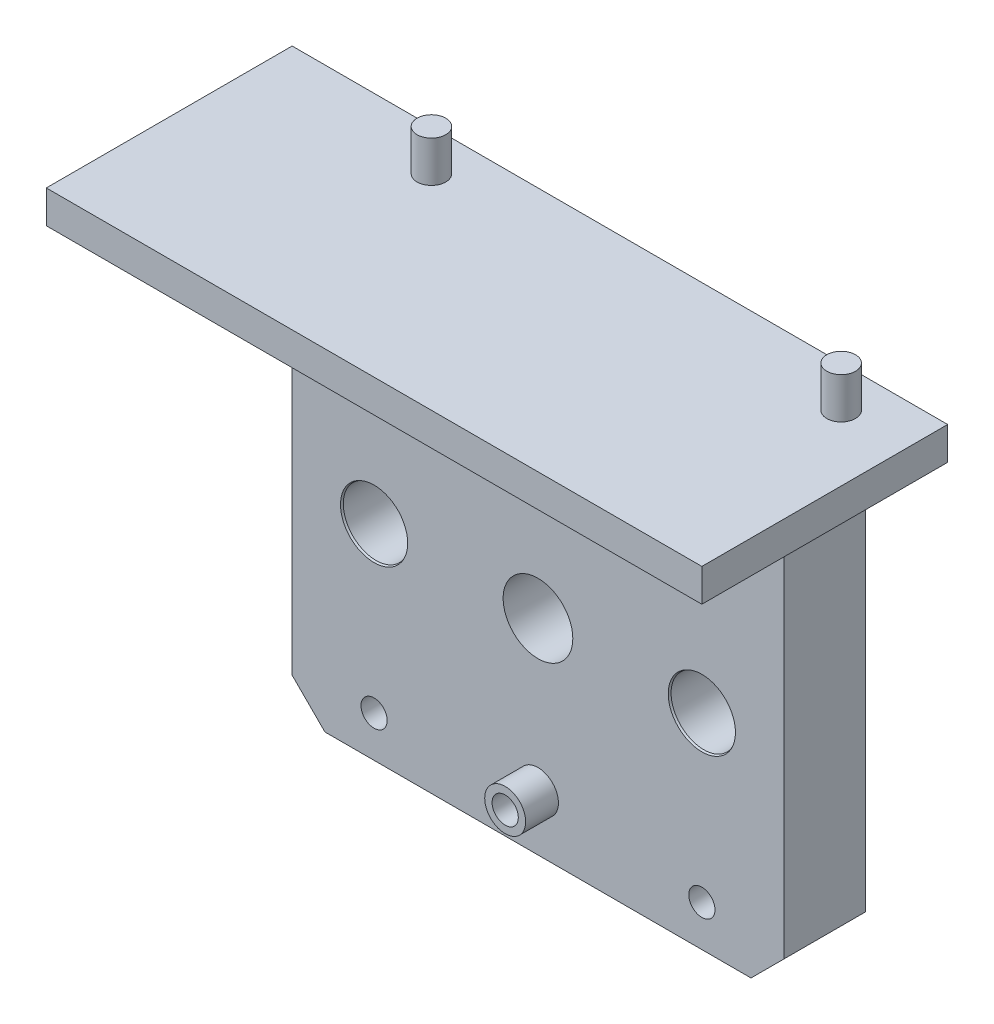
from build123d import *

# Parameters (mm, degrees)
SKETCH_1_W                = 60
SKETCH_1_H                = 50
EXTRUDE_1_DEPTH           = 10
HOLE_WIZARD_1_D           = 8.5
HOLE_WIZARD_1_DEPTH       = 20
HOLE_WIZARD_2_D           = 8
HOLE_WIZARD_2_CSINK_D     = 8.2
HOLE_WIZARD_2_CSINK_ANGLE = 45
SKETCH_9_R                = 2.5
EXTRUDE_3_DEPTH           = 4
HOLE_WIZARD_3_D           = 3.2
CHAMFER_1_SIZE            = 4
SKETCH_15_R               = 1.6
CUT_EXTRUDE_1_DEPTH       = 41.311288741
SKETCH_16_W               = 60
SKETCH_16_H               = 10
EXTRUDE_4_DEPTH           = 10.5
SKETCH_17_W               = 80
SKETCH_17_H               = 30
EXTRUDE_5_DEPTH           = 4
SKETCH_18_R               = 1.75
EXTRUDE_6_DEPTH           = 5


with BuildPart() as part:
    # 草图1 → 凸台-拉伸1 (new body)
    with BuildSketch(Plane.XY):
        Rectangle(SKETCH_1_W, SKETCH_1_H)
    extrude(amount=EXTRUDE_1_DEPTH)

    # 孔1
    with Locations(Plane.XY.offset(10)):
        with Locations((0, 0)):
            Hole(HOLE_WIZARD_1_D / 2, depth=HOLE_WIZARD_1_DEPTH)

    # 孔2 (through all)
    with Locations(Plane.XY.offset(10)):
        with Locations((20, 0), (-20, 0)):
            CounterSinkHole(HOLE_WIZARD_2_D / 2, HOLE_WIZARD_2_CSINK_D / 2, counter_sink_angle=HOLE_WIZARD_2_CSINK_ANGLE)

    # 草图9 → 凸台-拉伸3 (add)
    with BuildSketch(Plane.XY.offset(10)):
        with Locations((0, 18.25)):
            Circle(SKETCH_9_R)
        with Locations((0, -18.25)):
            Circle(SKETCH_9_R)
    extrude(amount=EXTRUDE_3_DEPTH)

    # 孔3 (through all)
    with Locations(Plane.XY.offset(14)):
        with Locations((0, 18.25), (0, -18.25)):
            Hole(HOLE_WIZARD_3_D / 2)

    # 倒角1
    chamfer_1_edges = [part.edges().sort_by_distance(p)[0] for p in [
        (30, -25, 5),
        (-30, -25, 5),
    ]]
    chamfer(chamfer_1_edges, length=CHAMFER_1_SIZE)

    # 草图15 → 切除-拉伸1 (cut, through all)
    with BuildSketch(Plane.XY.offset(10)):
        with Locations((-20, 20)):
            Circle(SKETCH_15_R)
        with Locations((20, 20)):
            Circle(SKETCH_15_R)
        with Locations((20, -20)):
            Circle(SKETCH_15_R)
        with Locations((-20, -20)):
            Circle(SKETCH_15_R)
    extrude(amount=-CUT_EXTRUDE_1_DEPTH, mode=Mode.SUBTRACT)

    # 草图16 → 凸台-拉伸4 (add)
    with BuildSketch(Plane(origin=(0, 25, 0), x_dir=(1, 0, 0), z_dir=(0, 1, 0))):
        with Locations((0, -5)):
            Rectangle(SKETCH_16_W, SKETCH_16_H)
    extrude(amount=EXTRUDE_4_DEPTH)

    # 草图17 → 凸台-拉伸5 (add)
    with BuildSketch(Plane(origin=(0, 35.5, 0), x_dir=(1, 0, 0), z_dir=(0, 1, 0))):
        with Locations((0, -15)):
            Rectangle(SKETCH_17_W, SKETCH_17_H)
    extrude(amount=-EXTRUDE_5_DEPTH)

    # 草图18 → 凸台-拉伸6 (add)
    with BuildSketch(Plane(origin=(0, 35.5, 0), x_dir=(1, 0, 0), z_dir=(0, 1, 0))):
        with Locations((32, -5)):
            Circle(SKETCH_18_R)
        with Locations((-18, -5)):
            Circle(SKETCH_18_R)
    extrude(amount=EXTRUDE_6_DEPTH)


solid = part.part
